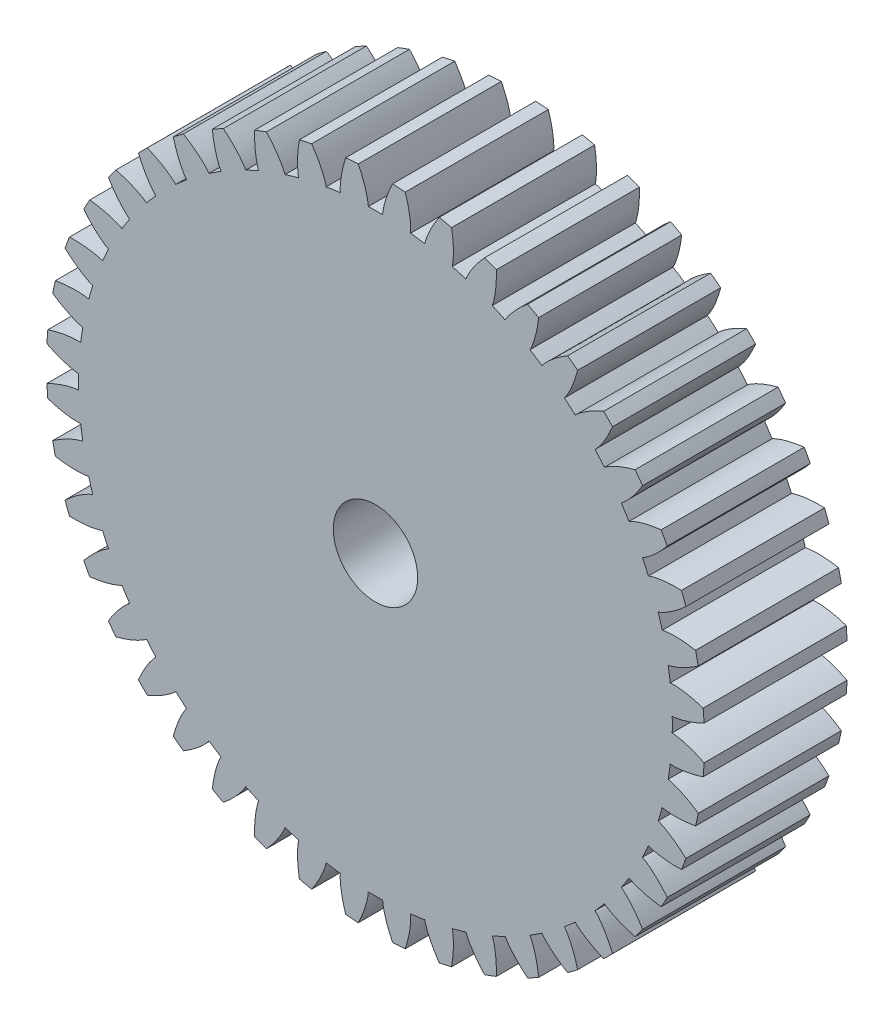
from build123d import *

# Parameters (mm, degrees)
SKETCH_1_R               = 11.5
SKETCH_1_R_2             = 1.475
EXTRUDE_1_DEPTH          = 5
CUT_EXTRUDE_1_DEPTH      = 18.014699527
PATTERN_CIRCULAR_1_COUNT = 44
PATTERN_CIRCULAR_1_ANGLE = 351.818181818


with BuildPart() as part:
    # 草图1 → 凸台-拉伸1 (new body)
    with BuildSketch(Plane.XY):
        Circle(SKETCH_1_R)
        Circle(SKETCH_1_R_2, mode=Mode.SUBTRACT)
    extrude(amount=EXTRUDE_1_DEPTH)

    # 草图1<3> → 切除-拉伸1 (cut, through all)
    with BuildSketch(Plane.XY):
        with BuildLine():
            add(Edge.make_bspline(
                [(10.371991331, 0.249841597), (10.401648067, 0.251556289), (10.470333186, 0.257887033), (10.608634349, 0.280898547), (10.813653138, 0.330927551), (11.064258894, 0.41342), (11.271555039, 0.49923231), (11.410488674, 0.564007957), (11.484314991, 0.600424178)],
                knots=[0.000683871, 0.000683871, 0.000683871, 0.000683871, 0.000683871, 0.002802034, 0.005604068, 0.010661158, 0.015718248, 0.021586579, 0.021586579, 0.021586579, 0.021586579, 0.021586579], degree=4))
            ThreePointArc((10.371991331, 0.249841597), (10.374247806, 0.124929856), (10.375, 0))
            ThreePointArc((10.375, 0), (10.374247806, -0.124929856), (10.371991331, -0.249841597))
            add(Edge.make_bspline(
                [(10.371991331, -0.249841597), (10.401648067, -0.251556289), (10.470333186, -0.257887033), (10.608634349, -0.280898547), (10.813653138, -0.330927551), (11.064258894, -0.41342), (11.271555039, -0.49923231), (11.410488674, -0.564007957), (11.484314991, -0.600424178)],
                knots=[0.000683871, 0.000683871, 0.000683871, 0.000683871, 0.000683871, 0.002802034, 0.005604068, 0.010661158, 0.015718248, 0.021586579, 0.021586579, 0.021586579, 0.021586579, 0.021586579], degree=4))
            ThreePointArc((11.484314991, -0.600424178), (11.496078079, -0.300314507), (11.5, 0))
            ThreePointArc((11.5, 0), (11.496078079, 0.300314507), (11.484314991, 0.600424178))
        make_face()
    cut_extrude_1 = extrude(amount=CUT_EXTRUDE_1_DEPTH, mode=Mode.SUBTRACT)

    # 阵列(圆周)1: 切除-拉伸1 ×44 about axis
    pattern_circular_1_axis = Axis((0, 0, 5), (0, 0, 1))
    for i in range(1, PATTERN_CIRCULAR_1_COUNT):
        add(cut_extrude_1.rotate(pattern_circular_1_axis, i * PATTERN_CIRCULAR_1_ANGLE / (PATTERN_CIRCULAR_1_COUNT - 1)), mode=Mode.SUBTRACT)


solid = part.part
